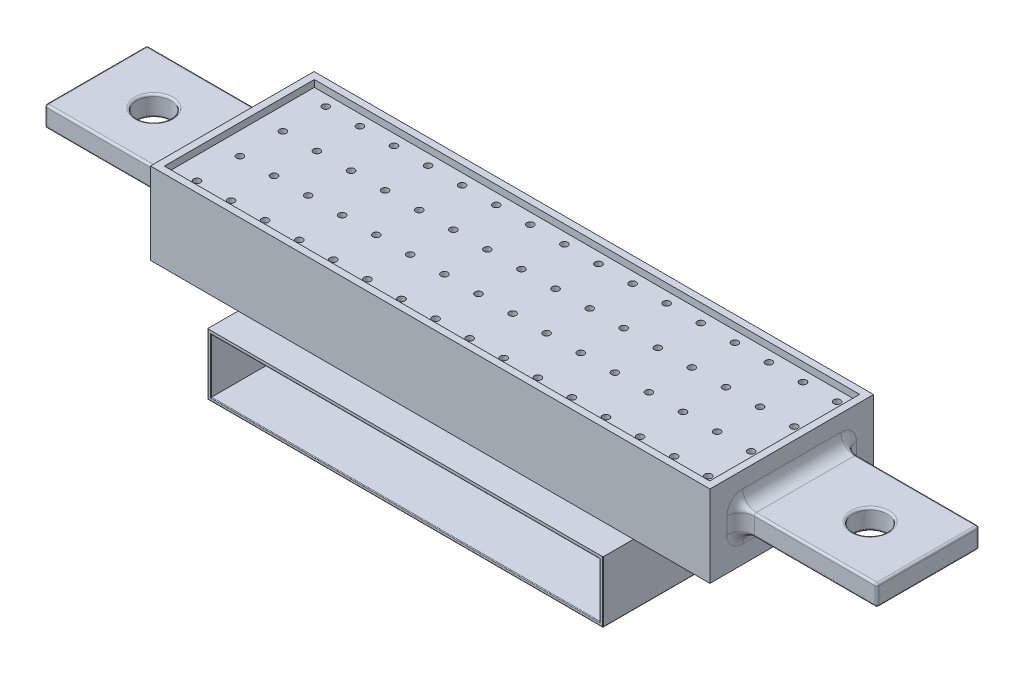
from build123d import *

# Parameters (mm, degrees)
SKETCH1_W           = 80
SKETCH1_H           = 22
SKETCH1_R           = 0.5
BOSS_EXTRUDE1_DEPTH = 10
BOSS_EXTRUDE2_START = -1
SKETCH6_W           = 82
SKETCH6_H           = 24
SKETCH6_W_2         = 80
SKETCH6_H_2         = 22
BOSS_EXTRUDE2_DEPTH = 12
SKETCH7_W           = 15
SKETCH7_H           = 3
BOSS_EXTRUDE3_DEPTH = 20
SKETCH8_R           = 2.5
CUT_EXTRUDE1_DEPTH  = 104.901468557
FILLET1_R           = 0.3
SKETCH10_W          = 58
SKETCH10_H          = 32
BOSS_EXTRUDE4_DEPTH = 9
SHELL1_START        = 0.5
SHELL1_OUTLINE_W    = 81.075214662
SHELL1_OUTLINE_H    = 23
SHELL1_OUTLINE_R    = 1
SHELL1_DEPTH        = 9
SHELL1_START_2      = -9.5
SHELL1_2_OUTLINE_W  = 57
SHELL1_2_OUTLINE_H  = 31.5
SHELL1_2_DEPTH      = 8
SHELL1_START_3      = 4.110326736
SHELL1_3_OUTLINE_W  = 20
SHELL1_3_OUTLINE_H  = 14
SHELL1_3_OUTLINE_R  = 3
SHELL1_3_DEPTH      = 2
SHELL1_START_4      = -0.5
SHELL1_4_OUTLINE_W  = 0.037607331
SHELL1_4_OUTLINE_H  = 23
SHELL1_4_DEPTH      = 11
FILLET2_R           = 0.1
FILLET3_R           = 2


# Read off the part's stored shape, not the designer's step: Shell1
with BuildPart() as part:
    # Sketch1 → Boss-Extrude1 (new body)
    with BuildSketch(Plane(origin=(0, 0, 0), x_dir=(1, 0, 0), z_dir=(0, 1, 0))):
        with Locations((40, 11)):
            Rectangle(SKETCH1_W, SKETCH1_H)
        with Locations(Location((78.276716264, 1.510550974, 0), (0, 0, 270))):
            Circle(SKETCH1_R, mode=Mode.SUBTRACT)
        with Locations(Location((73.276716264, 1.510550974, 0), (0, 0, 270))):
            Circle(SKETCH1_R, mode=Mode.SUBTRACT)
        with Locations(Location((68.276716264, 1.510550974, 0), (0, 0, 270))):
            Circle(SKETCH1_R, mode=Mode.SUBTRACT)
        with Locations(Location((63.276716264, 1.510550974, 0), (0, 0, 270))):
            Circle(SKETCH1_R, mode=Mode.SUBTRACT)
        with Locations(Location((58.276716264, 1.510550974, 0), (0, 0, 270))):
            Circle(SKETCH1_R, mode=Mode.SUBTRACT)
        with Locations(Location((53.276716264, 1.510550974, 0), (0, 0, 270))):
            Circle(SKETCH1_R, mode=Mode.SUBTRACT)
        with Locations(Location((48.276716264, 1.510550974, 0), (0, 0, 270))):
            Circle(SKETCH1_R, mode=Mode.SUBTRACT)
        with Locations(Location((43.276716264, 1.510550974, 0), (0, 0, 270))):
            Circle(SKETCH1_R, mode=Mode.SUBTRACT)
        with Locations(Location((38.276716264, 1.510550974, 0), (0, 0, 270))):
            Circle(SKETCH1_R, mode=Mode.SUBTRACT)
        with Locations(Location((33.276716264, 1.510550974, 0), (0, 0, 270))):
            Circle(SKETCH1_R, mode=Mode.SUBTRACT)
        with Locations(Location((28.276716264, 1.510550974, 0), (0, 0, 270))):
            Circle(SKETCH1_R, mode=Mode.SUBTRACT)
        with Locations(Location((23.276716264, 1.510550974, 0), (0, 0, 270))):
            Circle(SKETCH1_R, mode=Mode.SUBTRACT)
        with Locations(Location((18.276716264, 1.510550974, 0), (0, 0, 270))):
            Circle(SKETCH1_R, mode=Mode.SUBTRACT)
        with Locations(Location((13.276716264, 1.510550974, 0), (0, 0, 270))):
            Circle(SKETCH1_R, mode=Mode.SUBTRACT)
        with Locations(Location((8.276716264, 1.510550974, 0), (0, 0, 270))):
            Circle(SKETCH1_R, mode=Mode.SUBTRACT)
        with Locations(Location((3.276716264, 1.510550974, 0), (0, 0, 270))):
            Circle(SKETCH1_R, mode=Mode.SUBTRACT)
        with Locations(Location((73.276716264, 7.810550974, 0), (0, 0, 270))):
            Circle(SKETCH1_R, mode=Mode.SUBTRACT)
        with Locations(Location((68.276716264, 7.810550974, 0), (0, 0, 270))):
            Circle(SKETCH1_R, mode=Mode.SUBTRACT)
        with Locations(Location((63.276716264, 7.810550974, 0), (0, 0, 270))):
            Circle(SKETCH1_R, mode=Mode.SUBTRACT)
        with Locations(Location((58.276716264, 7.810550974, 0), (0, 0, 270))):
            Circle(SKETCH1_R, mode=Mode.SUBTRACT)
        with Locations(Location((53.276716264, 7.810550974, 0), (0, 0, 270))):
            Circle(SKETCH1_R, mode=Mode.SUBTRACT)
        with Locations(Location((48.276716264, 7.810550974, 0), (0, 0, 270))):
            Circle(SKETCH1_R, mode=Mode.SUBTRACT)
        with Locations(Location((43.276716264, 7.810550974, 0), (0, 0, 270))):
            Circle(SKETCH1_R, mode=Mode.SUBTRACT)
        with Locations(Location((38.276716264, 7.810550974, 0), (0, 0, 270))):
            Circle(SKETCH1_R, mode=Mode.SUBTRACT)
        with Locations(Location((33.276716264, 7.810550974, 0), (0, 0, 270))):
            Circle(SKETCH1_R, mode=Mode.SUBTRACT)
        with Locations(Location((28.276716264, 7.810550974, 0), (0, 0, 270))):
            Circle(SKETCH1_R, mode=Mode.SUBTRACT)
        with Locations(Location((23.276716264, 7.810550974, 0), (0, 0, 270))):
            Circle(SKETCH1_R, mode=Mode.SUBTRACT)
        with Locations(Location((18.276716264, 7.810550974, 0), (0, 0, 270))):
            Circle(SKETCH1_R, mode=Mode.SUBTRACT)
        with Locations(Location((13.276716264, 7.810550974, 0), (0, 0, 270))):
            Circle(SKETCH1_R, mode=Mode.SUBTRACT)
        with Locations(Location((8.276716264, 7.810550974, 0), (0, 0, 270))):
            Circle(SKETCH1_R, mode=Mode.SUBTRACT)
        with Locations(Location((3.276716264, 7.810550974, 0), (0, 0, 270))):
            Circle(SKETCH1_R, mode=Mode.SUBTRACT)
        with Locations(Location((73.276716264, 14.110550974, 0), (0, 0, 270))):
            Circle(SKETCH1_R, mode=Mode.SUBTRACT)
        with Locations(Location((68.276716264, 14.110550974, 0), (0, 0, 270))):
            Circle(SKETCH1_R, mode=Mode.SUBTRACT)
        with Locations(Location((63.276716264, 14.110550974, 0), (0, 0, 270))):
            Circle(SKETCH1_R, mode=Mode.SUBTRACT)
        with Locations(Location((58.276716264, 14.110550974, 0), (0, 0, 270))):
            Circle(SKETCH1_R, mode=Mode.SUBTRACT)
        with Locations(Location((53.276716264, 14.110550974, 0), (0, 0, 270))):
            Circle(SKETCH1_R, mode=Mode.SUBTRACT)
        with Locations(Location((48.276716264, 14.110550974, 0), (0, 0, 270))):
            Circle(SKETCH1_R, mode=Mode.SUBTRACT)
        with Locations(Location((43.276716264, 14.110550974, 0), (0, 0, 270))):
            Circle(SKETCH1_R, mode=Mode.SUBTRACT)
        with Locations(Location((38.276716264, 14.110550974, 0), (0, 0, 270))):
            Circle(SKETCH1_R, mode=Mode.SUBTRACT)
        with Locations(Location((33.276716264, 14.110550974, 0), (0, 0, 270))):
            Circle(SKETCH1_R, mode=Mode.SUBTRACT)
        with Locations(Location((28.276716264, 14.110550974, 0), (0, 0, 270))):
            Circle(SKETCH1_R, mode=Mode.SUBTRACT)
        with Locations(Location((23.276716264, 14.110550974, 0), (0, 0, 270))):
            Circle(SKETCH1_R, mode=Mode.SUBTRACT)
        with Locations(Location((18.276716264, 14.110550974, 0), (0, 0, 270))):
            Circle(SKETCH1_R, mode=Mode.SUBTRACT)
        with Locations(Location((13.276716264, 14.110550974, 0), (0, 0, 270))):
            Circle(SKETCH1_R, mode=Mode.SUBTRACT)
        with Locations(Location((8.276716264, 14.110550974, 0), (0, 0, 270))):
            Circle(SKETCH1_R, mode=Mode.SUBTRACT)
        with Locations(Location((3.276716264, 14.110550974, 0), (0, 0, 270))):
            Circle(SKETCH1_R, mode=Mode.SUBTRACT)
        with Locations(Location((73.276716264, 20.410550974, 0), (0, 0, 270))):
            Circle(SKETCH1_R, mode=Mode.SUBTRACT)
        with Locations(Location((68.276716264, 20.410550974, 0), (0, 0, 270))):
            Circle(SKETCH1_R, mode=Mode.SUBTRACT)
        with Locations(Location((63.276716264, 20.410550974, 0), (0, 0, 270))):
            Circle(SKETCH1_R, mode=Mode.SUBTRACT)
        with Locations(Location((58.276716264, 20.410550974, 0), (0, 0, 270))):
            Circle(SKETCH1_R, mode=Mode.SUBTRACT)
        with Locations(Location((53.276716264, 20.410550974, 0), (0, 0, 270))):
            Circle(SKETCH1_R, mode=Mode.SUBTRACT)
        with Locations(Location((48.276716264, 20.410550974, 0), (0, 0, 270))):
            Circle(SKETCH1_R, mode=Mode.SUBTRACT)
        with Locations(Location((43.276716264, 20.410550974, 0), (0, 0, 270))):
            Circle(SKETCH1_R, mode=Mode.SUBTRACT)
        with Locations(Location((38.276716264, 20.410550974, 0), (0, 0, 270))):
            Circle(SKETCH1_R, mode=Mode.SUBTRACT)
        with Locations(Location((33.276716264, 20.410550974, 0), (0, 0, 270))):
            Circle(SKETCH1_R, mode=Mode.SUBTRACT)
        with Locations(Location((28.276716264, 20.410550974, 0), (0, 0, 270))):
            Circle(SKETCH1_R, mode=Mode.SUBTRACT)
        with Locations(Location((23.276716264, 20.410550974, 0), (0, 0, 270))):
            Circle(SKETCH1_R, mode=Mode.SUBTRACT)
        with Locations(Location((18.276716264, 20.410550974, 0), (0, 0, 270))):
            Circle(SKETCH1_R, mode=Mode.SUBTRACT)
        with Locations(Location((13.276716264, 20.410550974, 0), (0, 0, 270))):
            Circle(SKETCH1_R, mode=Mode.SUBTRACT)
        with Locations(Location((8.276716264, 20.410550974, 0), (0, 0, 270))):
            Circle(SKETCH1_R, mode=Mode.SUBTRACT)
        with Locations(Location((3.276716264, 20.410550974, 0), (0, 0, 270))):
            Circle(SKETCH1_R, mode=Mode.SUBTRACT)
        with Locations(Location((78.276716264, 7.810550974, 0), (0, 0, 270))):
            Circle(SKETCH1_R, mode=Mode.SUBTRACT)
        with Locations(Location((78.276716264, 14.110550974, 0), (0, 0, 270))):
            Circle(SKETCH1_R, mode=Mode.SUBTRACT)
        with Locations(Location((78.276716264, 20.410550974, 0), (0, 0, 270))):
            Circle(SKETCH1_R, mode=Mode.SUBTRACT)
    extrude(amount=BOSS_EXTRUDE1_DEPTH)

    # Sketch6 → Boss-Extrude2 (add)
    with BuildSketch(Plane(origin=(0, 0, 0), x_dir=(1, 0, 0), z_dir=(0, 1, 0)).offset(BOSS_EXTRUDE2_START)):
        with Locations((39.962392669, 11)):
            Rectangle(SKETCH6_W, SKETCH6_H)
        with Locations((40, 11)):
            Rectangle(SKETCH6_W_2, SKETCH6_H_2, mode=Mode.SUBTRACT)
    boss_extrude2 = extrude(amount=BOSS_EXTRUDE2_DEPTH)

    # Sketch7 → Boss-Extrude3 (add)
    with BuildSketch(Plane.ZY.offset(1.037607331)):
        with Locations((-11, 5.110326736)):
            Rectangle(SKETCH7_W, SKETCH7_H)
    boss_extrude3 = extrude(amount=BOSS_EXTRUDE3_DEPTH)

    # Mirror2: Boss-Extrude2, Boss-Extrude3 across plane
    add(boss_extrude2.mirror(Plane(origin=(40, 0, 0), x_dir=(0, 0, 1), z_dir=(1, 0, 0))))
    add(boss_extrude3.mirror(Plane(origin=(40, 0, 0), x_dir=(0, 0, 1), z_dir=(1, 0, 0))))

    # Sketch8 → Cut-Extrude1 (cut, through all)
    with BuildSketch(Plane(origin=(0, 6.610326736, 0), x_dir=(1, 0, 0), z_dir=(0, 1, 0))):
        with Locations(Location((-12.537607331, 11, 0), (0, 0, 270))):
            Circle(SKETCH8_R)
    cut_extrude1 = extrude(amount=-CUT_EXTRUDE1_DEPTH, mode=Mode.SUBTRACT)

    # Mirror3: Cut-Extrude1 across plane
    add(cut_extrude1.mirror(Plane(origin=(40, 0, 0), x_dir=(0, 0, 1), z_dir=(1, 0, 0))), mode=Mode.SUBTRACT)

    # Fillet1
    fillet1_edges = [part.edges().sort_by_distance(p)[0] for p in [
        (-11.037607331, 3.610326736, -3.5),
        (-11.037607331, 6.610326736, -3.5),
        (-11.037607331, 6.610326736, -18.5),
        (-11.037607331, 3.610326736, -18.5),
        (-21.037607331, 5.110326736, -3.5),
        (-21.037607331, 6.610326736, -11),
        (-21.037607331, 5.110326736, -18.5),
        (-21.037607331, 3.610326736, -11),
        (101.037607331, 5.110326736, -3.5),
        (91.037607331, 6.610326736, -3.5),
        (101.037607331, 3.610326736, -11),
        (91.037607331, 3.610326736, -3.5),
        (101.037607331, 5.110326736, -18.5),
        (91.037607331, 3.610326736, -18.5),
        (101.037607331, 6.610326736, -11),
        (91.037607331, 6.610326736, -18.5),
        (-12.537607331, 3.610326736, -13.5),
        (-12.537607331, 6.610326736, -13.5),
        (92.537607331, 3.610326736, -13.5),
        (92.537607331, 6.610326736, -13.5),
    ]]
    fillet(fillet1_edges, radius=FILLET1_R)

    # Sketch10 → Boss-Extrude4 (add)
    with BuildSketch(Plane(origin=(0, -1, 0), x_dir=(1, 0, 0), z_dir=(0, 1, 0))):
        with Locations((40.819120301, 10.527322686)):
            Rectangle(SKETCH10_W, SKETCH10_H)
    extrude(amount=-BOSS_EXTRUDE4_DEPTH)

    # Shell1 outline → Shell1 (cut)
    with BuildSketch(Plane(origin=(0, 0, 0), x_dir=(1, 0, 0), z_dir=(0, 1, 0)).offset(SHELL1_START)):
        with Locations((40, 11)):
            Rectangle(SHELL1_OUTLINE_W, SHELL1_OUTLINE_H)
        with Locations((13.276716264, 1.510550974)):
            Circle(SHELL1_OUTLINE_R, mode=Mode.SUBTRACT)
        with Locations((13.276716264, 7.810550974)):
            Circle(SHELL1_OUTLINE_R, mode=Mode.SUBTRACT)
        with Locations((13.276716264, 14.110550974)):
            Circle(SHELL1_OUTLINE_R, mode=Mode.SUBTRACT)
        with Locations((13.276716264, 20.410550974)):
            Circle(SHELL1_OUTLINE_R, mode=Mode.SUBTRACT)
        with Locations((18.276716264, 1.510550974)):
            Circle(SHELL1_OUTLINE_R, mode=Mode.SUBTRACT)
        with Locations((23.276716264, 1.510550974)):
            Circle(SHELL1_OUTLINE_R, mode=Mode.SUBTRACT)
        with Locations((28.276716264, 1.510550974)):
            Circle(SHELL1_OUTLINE_R, mode=Mode.SUBTRACT)
        with Locations((33.276716264, 1.510550974)):
            Circle(SHELL1_OUTLINE_R, mode=Mode.SUBTRACT)
        with Locations((38.276716264, 1.510550974)):
            Circle(SHELL1_OUTLINE_R, mode=Mode.SUBTRACT)
        with Locations((18.276716264, 7.810550974)):
            Circle(SHELL1_OUTLINE_R, mode=Mode.SUBTRACT)
        with Locations((23.276716264, 7.810550974)):
            Circle(SHELL1_OUTLINE_R, mode=Mode.SUBTRACT)
        with Locations((28.276716264, 7.810550974)):
            Circle(SHELL1_OUTLINE_R, mode=Mode.SUBTRACT)
        with Locations((33.276716264, 7.810550974)):
            Circle(SHELL1_OUTLINE_R, mode=Mode.SUBTRACT)
        with Locations((38.276716264, 7.810550974)):
            Circle(SHELL1_OUTLINE_R, mode=Mode.SUBTRACT)
        with Locations((43.276716264, 1.510550974)):
            Circle(SHELL1_OUTLINE_R, mode=Mode.SUBTRACT)
        with Locations((48.276716264, 1.510550974)):
            Circle(SHELL1_OUTLINE_R, mode=Mode.SUBTRACT)
        with Locations((53.276716264, 1.510550974)):
            Circle(SHELL1_OUTLINE_R, mode=Mode.SUBTRACT)
        with Locations((58.276716264, 1.510550974)):
            Circle(SHELL1_OUTLINE_R, mode=Mode.SUBTRACT)
        with Locations((63.276716264, 1.510550974)):
            Circle(SHELL1_OUTLINE_R, mode=Mode.SUBTRACT)
        with Locations((68.276716264, 1.510550974)):
            Circle(SHELL1_OUTLINE_R, mode=Mode.SUBTRACT)
        with Locations((43.276716264, 7.810550974)):
            Circle(SHELL1_OUTLINE_R, mode=Mode.SUBTRACT)
        with Locations((48.276716264, 7.810550974)):
            Circle(SHELL1_OUTLINE_R, mode=Mode.SUBTRACT)
        with Locations((53.276716264, 7.810550974)):
            Circle(SHELL1_OUTLINE_R, mode=Mode.SUBTRACT)
        with Locations((58.276716264, 7.810550974)):
            Circle(SHELL1_OUTLINE_R, mode=Mode.SUBTRACT)
        with Locations((63.276716264, 7.810550974)):
            Circle(SHELL1_OUTLINE_R, mode=Mode.SUBTRACT)
        with Locations((68.276716264, 7.810550974)):
            Circle(SHELL1_OUTLINE_R, mode=Mode.SUBTRACT)
        with Locations((18.276716264, 14.110550974)):
            Circle(SHELL1_OUTLINE_R, mode=Mode.SUBTRACT)
        with Locations((23.276716264, 14.110550974)):
            Circle(SHELL1_OUTLINE_R, mode=Mode.SUBTRACT)
        with Locations((28.276716264, 14.110550974)):
            Circle(SHELL1_OUTLINE_R, mode=Mode.SUBTRACT)
        with Locations((33.276716264, 14.110550974)):
            Circle(SHELL1_OUTLINE_R, mode=Mode.SUBTRACT)
        with Locations((38.276716264, 14.110550974)):
            Circle(SHELL1_OUTLINE_R, mode=Mode.SUBTRACT)
        with Locations((18.276716264, 20.410550974)):
            Circle(SHELL1_OUTLINE_R, mode=Mode.SUBTRACT)
        with Locations((23.276716264, 20.410550974)):
            Circle(SHELL1_OUTLINE_R, mode=Mode.SUBTRACT)
        with Locations((28.276716264, 20.410550974)):
            Circle(SHELL1_OUTLINE_R, mode=Mode.SUBTRACT)
        with Locations((33.276716264, 20.410550974)):
            Circle(SHELL1_OUTLINE_R, mode=Mode.SUBTRACT)
        with Locations((38.276716264, 20.410550974)):
            Circle(SHELL1_OUTLINE_R, mode=Mode.SUBTRACT)
        with Locations((43.276716264, 14.110550974)):
            Circle(SHELL1_OUTLINE_R, mode=Mode.SUBTRACT)
        with Locations((48.276716264, 14.110550974)):
            Circle(SHELL1_OUTLINE_R, mode=Mode.SUBTRACT)
        with Locations((53.276716264, 14.110550974)):
            Circle(SHELL1_OUTLINE_R, mode=Mode.SUBTRACT)
        with Locations((58.276716264, 14.110550974)):
            Circle(SHELL1_OUTLINE_R, mode=Mode.SUBTRACT)
        with Locations((63.276716264, 14.110550974)):
            Circle(SHELL1_OUTLINE_R, mode=Mode.SUBTRACT)
        with Locations((68.276716264, 14.110550974)):
            Circle(SHELL1_OUTLINE_R, mode=Mode.SUBTRACT)
        with Locations((43.276716264, 20.410550974)):
            Circle(SHELL1_OUTLINE_R, mode=Mode.SUBTRACT)
        with Locations((48.276716264, 20.410550974)):
            Circle(SHELL1_OUTLINE_R, mode=Mode.SUBTRACT)
        with Locations((53.276716264, 20.410550974)):
            Circle(SHELL1_OUTLINE_R, mode=Mode.SUBTRACT)
        with Locations((58.276716264, 20.410550974)):
            Circle(SHELL1_OUTLINE_R, mode=Mode.SUBTRACT)
        with Locations((63.276716264, 20.410550974)):
            Circle(SHELL1_OUTLINE_R, mode=Mode.SUBTRACT)
        with Locations((68.276716264, 20.410550974)):
            Circle(SHELL1_OUTLINE_R, mode=Mode.SUBTRACT)
        with Locations((78.276716264, 20.410550974)):
            Circle(SHELL1_OUTLINE_R, mode=Mode.SUBTRACT)
        with Locations((73.276716264, 1.510550974)):
            Circle(SHELL1_OUTLINE_R, mode=Mode.SUBTRACT)
        with Locations((78.276716264, 1.510550974)):
            Circle(SHELL1_OUTLINE_R, mode=Mode.SUBTRACT)
        with Locations((73.276716264, 7.810550974)):
            Circle(SHELL1_OUTLINE_R, mode=Mode.SUBTRACT)
        with Locations((78.276716264, 7.810550974)):
            Circle(SHELL1_OUTLINE_R, mode=Mode.SUBTRACT)
        with Locations((73.276716264, 14.110550974)):
            Circle(SHELL1_OUTLINE_R, mode=Mode.SUBTRACT)
        with Locations((78.276716264, 14.110550974)):
            Circle(SHELL1_OUTLINE_R, mode=Mode.SUBTRACT)
        with Locations((73.276716264, 20.410550974)):
            Circle(SHELL1_OUTLINE_R, mode=Mode.SUBTRACT)
        with Locations((8.276716264, 7.810550974)):
            Circle(SHELL1_OUTLINE_R, mode=Mode.SUBTRACT)
        with Locations((3.276716264, 14.110550974)):
            Circle(SHELL1_OUTLINE_R, mode=Mode.SUBTRACT)
        with Locations((8.276716264, 14.110550974)):
            Circle(SHELL1_OUTLINE_R, mode=Mode.SUBTRACT)
        with Locations((3.276716264, 20.410550974)):
            Circle(SHELL1_OUTLINE_R, mode=Mode.SUBTRACT)
        with Locations((8.276716264, 20.410550974)):
            Circle(SHELL1_OUTLINE_R, mode=Mode.SUBTRACT)
        with Locations((3.276716264, 1.510550974)):
            Circle(SHELL1_OUTLINE_R, mode=Mode.SUBTRACT)
        with Locations((8.276716264, 1.510550974)):
            Circle(SHELL1_OUTLINE_R, mode=Mode.SUBTRACT)
        with Locations((3.276716264, 7.810550974)):
            Circle(SHELL1_OUTLINE_R, mode=Mode.SUBTRACT)
    extrude(amount=SHELL1_DEPTH, mode=Mode.SUBTRACT)

    # Shell1 2 outline → Shell1 2 (cut)
    with BuildSketch(Plane(origin=(0, 0, 0), x_dir=(1, 0, 0), z_dir=(0, 1, 0)).offset(SHELL1_START_2)):
        with Locations((40.819120301, 10.277322686)):
            Rectangle(SHELL1_2_OUTLINE_W, SHELL1_2_OUTLINE_H)
    extrude(amount=SHELL1_2_DEPTH, mode=Mode.SUBTRACT)

    # Shell1 3 outline → Shell1 3 (cut)
    # profile 1 of 2: a face of its own
    with BuildSketch(Plane(origin=(0, 0, 0), x_dir=(1, 0, 0), z_dir=(0, 1, 0)).offset(SHELL1_START_3)):
        with Locations((-10.537607331, 11)):
            Rectangle(SHELL1_3_OUTLINE_W, SHELL1_3_OUTLINE_H)
        with Locations((-12.537607331, 11)):
            Circle(SHELL1_3_OUTLINE_R, mode=Mode.SUBTRACT)
    # profile 2 of 2: a face of its own
    with BuildSketch(Plane(origin=(0, 0, 0), x_dir=(1, 0, 0), z_dir=(0, 1, 0)).offset(SHELL1_START_3)):
        with Locations((90.537607331, 11)):
            Rectangle(SHELL1_3_OUTLINE_W, SHELL1_3_OUTLINE_H)
        with Locations((92.537607331, 11)):
            Circle(SHELL1_3_OUTLINE_R, mode=Mode.SUBTRACT)
    extrude(amount=SHELL1_3_DEPTH, mode=Mode.SUBTRACT)

    # Shell1 4 outline → Shell1 4 (cut)
    with BuildSketch(Plane(origin=(0, 0, 0), x_dir=(1, 0, 0), z_dir=(0, 1, 0)).offset(SHELL1_START_4)):
        with Locations((-0.518803666, 11)):
            Rectangle(SHELL1_4_OUTLINE_W, SHELL1_4_OUTLINE_H)
        with Locations((80.518803666, 11)):
            Rectangle(SHELL1_4_OUTLINE_W, SHELL1_4_OUTLINE_H)
    extrude(amount=SHELL1_4_DEPTH, mode=Mode.SUBTRACT)

    # Fillet2
    fillet2_edges = [part.edges().sort_by_distance(p)[0] for p in [
        (11.819120301, -10, -10.527322686),
        (11.819120301, -5.5, 5.472677314),
        (40.819120301, -10, -26.527322686),
        (11.819120301, -5.5, -26.527322686),
        (69.819120301, -10, -10.527322686),
        (69.819120301, -5.5, -26.527322686),
        (40.819120301, -10, 5.472677314),
        (69.819120301, -5.5, 5.472677314),
        (40.819120301, -1.5, 5.472677314),
        (12.319120301, -5.5, 5.472677314),
        (40.819120301, -9.5, 5.472677314),
        (69.319120301, -5.5, 5.472677314),
    ]]
    fillet(fillet2_edges, radius=FILLET2_R)

    # Fillet3
    fillet3_edges = [part.edges().sort_by_distance(p)[0] for p in [
        (81.037607331, 6.610326736, -11),
        (81.037607331, 3.610326736, -11),
        (81.037607331, 5.110326736, -18.5),
        (81.037607331, 5.110326736, -3.5),
        (-1.037607331, 3.610326736, -11),
        (-1.037607331, 6.610326736, -11),
        (-1.037607331, 5.110326736, -18.5),
        (-1.037607331, 5.110326736, -3.5),
        (81.037607331, 3.698194702, -18.412132034),
        (81.037607331, 3.698194702, -3.587867966),
        (81.037607331, 6.522458771, -18.412132034),
        (81.037607331, 6.522458771, -3.587867966),
        (-1.037607331, 3.698194702, -18.412132034),
        (-1.037607331, 6.522458771, -18.412132034),
        (-1.037607331, 3.698194702, -3.587867966),
        (-1.037607331, 6.522458771, -3.587867966),
        (80.537607331, 6.110326736, -11),
    ]]
    fillet(fillet3_edges, radius=FILLET3_R)


solid = part.part
